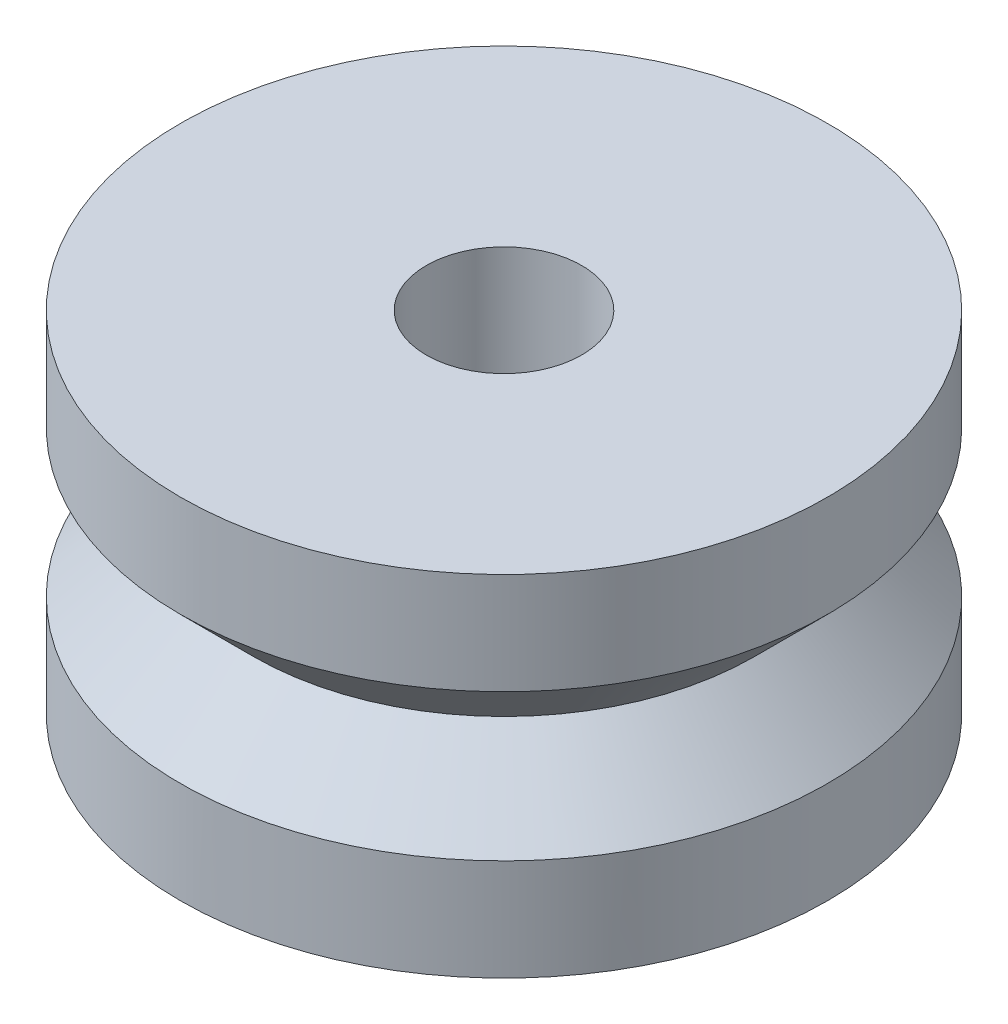
from build123d import *

# Parameters (mm, degrees)
SKETCH1_R           = 25
SKETCH1_R_2         = 6
BOSS_EXTRUDE1_DEPTH = 27


with BuildPart() as part:
    # Sketch1 → Boss-Extrude1 (new body)
    with BuildSketch(Plane(origin=(0, 0, 0), x_dir=(1, 0, 0), z_dir=(0, 1, 0))):
        Circle(SKETCH1_R)
        Circle(SKETCH1_R_2, mode=Mode.SUBTRACT)
    extrude(amount=BOSS_EXTRUDE1_DEPTH)

    # Cut-Sweep1: sweep along a curve in space
    with BuildLine() as cut_sweep1_path:
        ThreePointArc((0, 0, 25), (17.67766953, 0, 17.67766953), (25, 0, 0))
        ThreePointArc((25, 0, 0), (17.67766953, 0, -17.67766953), (0, 0, -25))
        ThreePointArc((0, 0, -25), (-17.67766953, 0, -17.67766953), (-25, 0, 0))
        ThreePointArc((-25, 0, 0), (-17.67766953, 0, 17.67766953), (0, 0, 25))
    # Sketch4 → Cut-Sweep1 (sweep, cut)
    with BuildSketch(Plane.XY):
        Polygon((25.323275307, 19.480129556), (19.343145751, 13.5), (25.323275307, 7.519870444), align=None)
    sweep(path=cut_sweep1_path.line, mode=Mode.SUBTRACT)


solid = part.part
